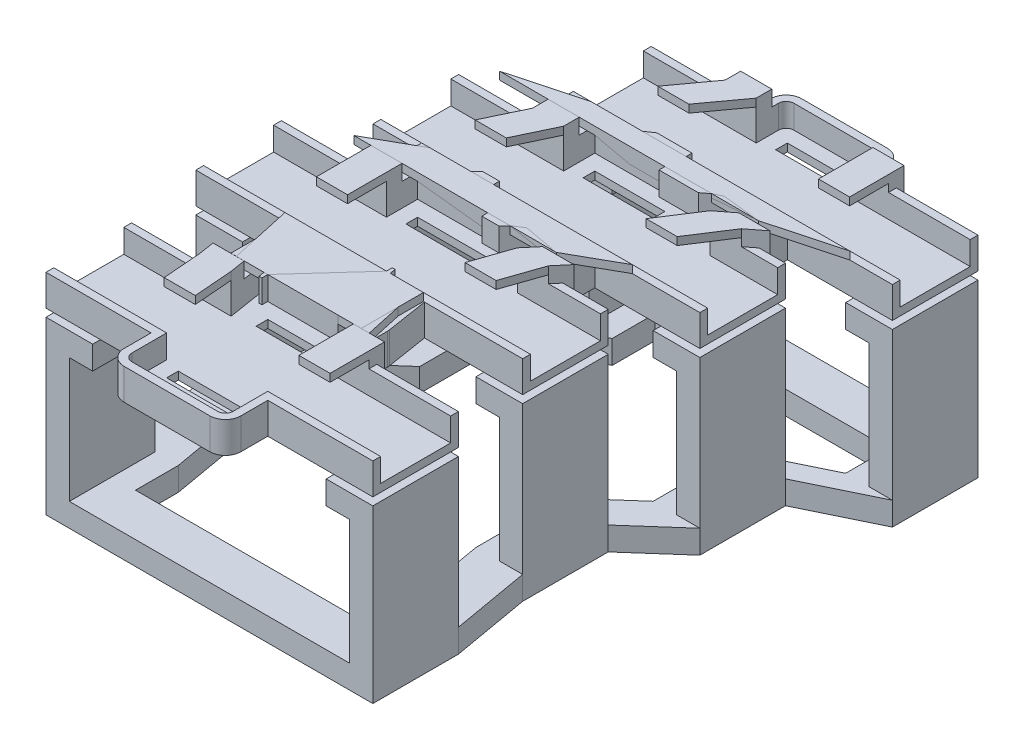
from build123d import *

# Parameters (mm, degrees)
EXTRUDE_1_DEPTH      = 1
SKETCH_11_W          = 9
SKETCH_11_H          = 1.5
CUT_EXTRUDE_3_DEPTH  = 1
FILLET_2_R           = 1
SKETCH_14_W          = 40
SKETCH_14_H          = 9
EXTRUDE_5_DEPTH      = 1
EXTRUDE_6_DEPTH      = 3
EXTRUDE_6_DEPTH_BACK = 1
SKETCH_16_W          = 1
SKETCH_16_H          = 9
CUT_EXTRUDE_4_DEPTH  = 3
EXTRUDE_START        = 1
EXTRUDE_8_DEPTH      = 1
SKETCH_18_W          = 4
SKETCH_18_H          = 5
EXTRUDE_8_2_DEPTH    = 1
EXTRUDE_8_3_DEPTH    = 1
EXTRUDE_8_4_DEPTH    = 1
EXTRUDE_8_5_DEPTH    = 1
EXTRUDE_8_6_DEPTH    = 1
EXTRUDE_8_7_DEPTH    = 1
EXTRUDE_8_8_DEPTH    = 1
SKETCH_19_W          = 4
SKETCH_19_H          = 1
EXTRUDE_9_DEPTH      = 2
EXTRUDE_START_2      = 3
EXTRUDE_11_DEPTH     = 2
EXTRUDE_11_2_DEPTH   = 2
EXTRUDE_11_3_DEPTH   = 2
EXTRUDE_12_DEPTH     = 1
SKETCH_23_W          = 4
SKETCH_23_H          = 1
EXTRUDE_13_DEPTH     = 6
SKETCH_24_W          = 3
SKETCH_24_H          = 11
EXTRUDE_14_DEPTH     = 22
EXTRUDE_14_2_DEPTH   = 22
EXTRUDE_14_3_DEPTH   = 22
EXTRUDE_14_4_DEPTH   = 22
EXTRUDE_14_5_DEPTH   = 22
EXTRUDE_14_6_DEPTH   = 22
EXTRUDE_14_7_DEPTH   = 22
EXTRUDE_14_8_DEPTH   = 22
SKETCH_25_W          = 3
SKETCH_25_H          = 11
EXTRUDE_15_DEPTH     = 3
EXTRUDE_16_DEPTH     = 3
EXTRUDE_START_3      = 2
EXTRUDE_17_DEPTH     = 2
EXTRUDE_17_2_DEPTH   = 2
EXTRUDE_17_3_DEPTH   = 2
EXTRUDE_18_DEPTH     = 1


with BuildPart() as part:
    # 草图5 → 凸台-拉伸1 (new body)
    with BuildSketch(Plane(origin=(0, 0, 0), x_dir=(1, 0, 0), z_dir=(0, 1, 0))):
        Polygon((-30, -9.95), (-17, -9.95), (-17, 9.95), (-18.75, 21), (-12.5, 28.372711642), (-12.5, 37.522711642), (-3.25, 44.664645027), (-3.25, 61.364645027), (-16.25, 61.364645027), (-16.25, 53.014645027), (-25.5, 46.672711642), (-25.5, 37.522711642), (-31.75, 30.95), (-31.75, 11.05), (-30, 0), align=None)
    extrude(amount=EXTRUDE_1_DEPTH)

    # 草图11 → 切除-拉伸3 (cut)
    with BuildSketch(Plane(origin=(0, 1, 0), x_dir=(1, 0, 0), z_dir=(0, 1, 0))):
        with Locations((-23.5, -5.75)):
            Rectangle(SKETCH_11_W, SKETCH_11_H)
        with Locations((-23.5, 5.75)):
            Rectangle(SKETCH_11_W, SKETCH_11_H)
        with Locations((-25.25, 15.25)):
            Rectangle(SKETCH_11_W, SKETCH_11_H)
        with Locations((-25.25, 26.75)):
            Rectangle(SKETCH_11_W, SKETCH_11_H)
        with Locations((-19, 31.772711642)):
            Rectangle(SKETCH_11_W, SKETCH_11_H)
        with Locations((-19, 43.272711642)):
            Rectangle(SKETCH_11_W, SKETCH_11_H)
        with Locations((-9.75, 47.264645027)):
            Rectangle(SKETCH_11_W, SKETCH_11_H)
        with Locations((-9.75, 58.764645027)):
            Rectangle(SKETCH_11_W, SKETCH_11_H)
    extrude(amount=-CUT_EXTRUDE_3_DEPTH, mode=Mode.SUBTRACT)

    # 圆角2
    fillet_2_edges = [part.edges().sort_by_distance(p)[0] for p in [
        (-31.75, 0.5, -11.05),
        (-30, 0.5, 0),
        (-30, 0.5, 9.95),
        (-17, 0.5, 9.95),
        (-17, 0.5, -9.95),
        (-18.75, 0.5, -21),
        (-12.5, 0.5, -28.372711642),
        (-12.5, 0.5, -37.522711642),
        (-3.25, 0.5, -44.664645027),
        (-3.25, 0.5, -61.364645027),
        (-16.25, 0.5, -61.364645027),
        (-16.25, 0.5, -53.014645027),
        (-25.5, 0.5, -46.672711642),
        (-25.5, 0.5, -37.522711642),
        (-31.75, 0.5, -30.95),
    ]]
    fillet(fillet_2_edges, radius=FILLET_2_R)

    # 草图14 → 凸台-拉伸5 (add)
    with BuildSketch(Plane(origin=(0, 1, 0), x_dir=(1, 0, 0), z_dir=(0, 1, 0))):
        with Locations((-23.5, 0)):
            Rectangle(SKETCH_14_W, SKETCH_14_H)
        with Locations((-25.25, 21)):
            Rectangle(SKETCH_14_W, SKETCH_14_H)
        with Locations((-19, 37.522711642)):
            Rectangle(SKETCH_14_W, SKETCH_14_H)
        with Locations((-9.75, 53.014645027)):
            Rectangle(SKETCH_14_W, SKETCH_14_H)
    extrude(amount=-EXTRUDE_5_DEPTH)

    # 草图15 → 凸台-拉伸6 (add, two sides: drawn at the far end of the back side and taken through both)
    with BuildSketch(Plane(origin=(0, 1, 0), x_dir=(1, 0, 0), z_dir=(0, 1, 0)).offset(-EXTRUDE_6_DEPTH_BACK)):
        with BuildLine():
            Line((-17.25, 60.364645027), (-17.25, 58.514645027))
            Line((-17.25, 58.514645027), (-30.75, 58.514645027))
            Line((-30.75, 58.514645027), (-30.75, 47.514645027))
            Line((-30.75, 47.514645027), (-25.958230177, 47.514645027))
            ThreePointArc((-25.958230177, 47.514645027), (-26.359631731, 46.881912962), (-26.5, 46.145862812))
            Line((-26.5, 46.145862812), (-26.5, 43.022711642))
            Line((-26.5, 43.022711642), (-40, 43.022711642))
            Line((-40, 43.022711642), (-40, 32.022711642))
            Line((-40, 32.022711642), (-32.109889455, 32.022711642))
            Line((-32.109889455, 32.022711642), (-32.19934642, 31.928635668))
            ThreePointArc((-32.19934642, 31.928635668), (-32.607241616, 31.292510645), (-32.75, 30.550450283))
            Line((-32.75, 30.550450283), (-32.75, 26.5))
            Line((-32.75, 26.5), (-46.25, 26.5))
            Line((-46.25, 26.5), (-46.25, 15.5))
            Line((-46.25, 15.5), (-32.75, 15.5))
            Line((-32.75, 15.5), (-32.75, 11.12869513))
            ThreePointArc((-32.75, 11.12869513), (-32.743835693, 10.97178997), (-32.725380771, 10.815852022))
            Line((-32.725380771, 10.815852022), (-31.883503754, 5.5))
            Line((-31.883503754, 5.5), (-44.5, 5.5))
            Line((-44.5, 5.5), (-44.5, -5.5))
            Line((-44.5, -5.5), (-31, -5.5))
            Line((-31, -5.5), (-31, -8.95))
            ThreePointArc((-31, -8.95), (-30.414213562, -10.364213562), (-29, -10.95))
            Line((-29, -10.95), (-18, -10.95))
            ThreePointArc((-18, -10.95), (-16.585786438, -10.364213562), (-16, -8.95))
            Line((-16, -8.95), (-16, -5.5))
            Line((-16, -5.5), (-2.5, -5.5))
            Line((-2.5, -5.5), (-2.5, 5.5))
            Line((-2.5, 5.5), (-16, 5.5))
            Line((-16, 5.5), (-16, 9.87130487))
            ThreePointArc((-16, 9.87130487), (-16.006164307, 10.02821003), (-16.024619229, 10.184147978))
            Line((-16.024619229, 10.184147978), (-16.866496246, 15.5))
            Line((-16.866496246, 15.5), (-4.25, 15.5))
            Line((-4.25, 15.5), (-4.25, 26.5))
            Line((-4.25, 26.5), (-12.776570938, 26.5))
            Line((-12.776570938, 26.5), (-11.974406742, 27.446260049))
            ThreePointArc((-11.974406742, 27.446260049), (-11.62234368, 28.050765068), (-11.5, 28.739536977))
            Line((-11.5, 28.739536977), (-11.5, 32.022711642))
            Line((-11.5, 32.022711642), (2, 32.022711642))
            Line((2, 32.022711642), (2, 43.022711642))
            Line((2, 43.022711642), (-3.740284512, 43.022711642))
            Line((-3.740284512, 43.022711642), (-3.027725945, 43.572878758))
            ThreePointArc((-3.027725945, 43.572878758), (-2.454930627, 44.274040672), (-2.25, 45.155928389))
            Line((-2.25, 45.155928389), (-2.25, 47.514645027))
            Line((-2.25, 47.514645027), (11.25, 47.514645027))
            Line((11.25, 47.514645027), (11.25, 58.514645027))
            Line((11.25, 58.514645027), (-2.25, 58.514645027))
            Line((-2.25, 58.514645027), (-2.25, 60.364645027))
            ThreePointArc((-2.25, 60.364645027), (-2.835786438, 61.778858589), (-4.25, 62.364645027))
            Line((-4.25, 62.364645027), (-15.25, 62.364645027))
            ThreePointArc((-15.25, 62.364645027), (-16.664213562, 61.778858589), (-17.25, 60.364645027))
        make_face()
        with BuildLine():
            Line((-16.25, 60.364645027), (-16.25, 57.514645027))
            Line((-16.25, 57.514645027), (-29.75, 57.514645027))
            Line((-29.75, 57.514645027), (-29.75, 48.514645027))
            Line((-29.75, 48.514645027), (-22.813455885, 48.514645027))
            Line((-22.813455885, 48.514645027), (-25.065472331, 46.970630078))
            ThreePointArc((-25.065472331, 46.970630078), (-25.384723779, 46.6119785), (-25.5, 46.145862812))
            Line((-25.5, 46.145862812), (-25.5, 42.022711642))
            Line((-25.5, 42.022711642), (-39, 42.022711642))
            Line((-39, 42.022711642), (-39, 33.022711642))
            Line((-39, 33.022711642), (-29.779055819, 33.022711642))
            Line((-29.779055819, 33.022711642), (-31.47467321, 31.239542976))
            ThreePointArc((-31.47467321, 31.239542976), (-31.678620808, 30.921480464), (-31.75, 30.550450283))
            Line((-31.75, 30.550450283), (-31.75, 25.5))
            Line((-31.75, 25.5), (-45.25, 25.5))
            Line((-45.25, 25.5), (-45.25, 16.5))
            Line((-45.25, 16.5), (-31.75, 16.5))
            Line((-31.75, 16.5), (-31.75, 11.12869513))
            ThreePointArc((-31.75, 11.12869513), (-31.746917847, 11.05024255), (-31.737690385, 10.972273576))
            Line((-31.737690385, 10.972273576), (-30.712669683, 4.5))
            Line((-30.712669683, 4.5), (-43.5, 4.5))
            Line((-43.5, 4.5), (-43.5, -4.5))
            Line((-43.5, -4.5), (-30, -4.5))
            Line((-30, -4.5), (-30, -8.95))
            ThreePointArc((-30, -8.95), (-29.707106781, -9.657106781), (-29, -9.95))
            Line((-29, -9.95), (-18, -9.95))
            ThreePointArc((-18, -9.95), (-17.292893219, -9.657106781), (-17, -8.95))
            Line((-17, -8.95), (-17, -4.5))
            Line((-17, -4.5), (-3.5, -4.5))
            Line((-3.5, -4.5), (-3.5, 4.5))
            Line((-3.5, 4.5), (-17, 4.5))
            Line((-17, 4.5), (-17, 9.87130487))
            ThreePointArc((-17, 9.87130487), (-17.003082153, 9.94975745), (-17.012309615, 10.027726424))
            Line((-17.012309615, 10.027726424), (-18.037330317, 16.5))
            Line((-18.037330317, 16.5), (-5.25, 16.5))
            Line((-5.25, 16.5), (-5.25, 25.5))
            Line((-5.25, 25.5), (-14.935257017, 25.5))
            Line((-14.935257017, 25.5), (-12.737203371, 28.092898513))
            ThreePointArc((-12.737203371, 28.092898513), (-12.56117184, 28.395151022), (-12.5, 28.739536977))
            Line((-12.5, 28.739536977), (-12.5, 33.022711642))
            Line((-12.5, 33.022711642), (1, 33.022711642))
            Line((1, 33.022711642), (1, 42.022711642))
            Line((1, 42.022711642), (-6.671746255, 42.022711642))
            Line((-6.671746255, 42.022711642), (-3.638862972, 44.364403573))
            ThreePointArc((-3.638862972, 44.364403573), (-3.352465313, 44.71498453), (-3.25, 45.155928389))
            Line((-3.25, 45.155928389), (-3.25, 48.514645027))
            Line((-3.25, 48.514645027), (10.25, 48.514645027))
            Line((10.25, 48.514645027), (10.25, 57.514645027))
            Line((10.25, 57.514645027), (-3.25, 57.514645027))
            Line((-3.25, 57.514645027), (-3.25, 60.364645027))
            ThreePointArc((-3.25, 60.364645027), (-3.542893219, 61.071751808), (-4.25, 61.364645027))
            Line((-4.25, 61.364645027), (-15.25, 61.364645027))
            ThreePointArc((-15.25, 61.364645027), (-15.957106781, 61.071751808), (-16.25, 60.364645027))
        make_face(mode=Mode.SUBTRACT)
    extrude(amount=EXTRUDE_6_DEPTH + EXTRUDE_6_DEPTH_BACK)

    # 草图16 → 切除-拉伸4 (cut)
    with BuildSketch(Plane(origin=(0, 4, 0), x_dir=(1, 0, 0), z_dir=(0, 1, 0))):
        with Locations((-44, 0)):
            Rectangle(SKETCH_16_W, SKETCH_16_H)
        with Locations((-3, 0)):
            Rectangle(SKETCH_16_W, SKETCH_16_H)
        with Locations((-45.75, 21)):
            Rectangle(SKETCH_16_W, SKETCH_16_H)
        with Locations((-4.75, 21)):
            Rectangle(SKETCH_16_W, SKETCH_16_H)
        with Locations((-39.5, 37.522711642)):
            Rectangle(SKETCH_16_W, SKETCH_16_H)
        with Locations((1.5, 37.522711642)):
            Rectangle(SKETCH_16_W, SKETCH_16_H)
        with Locations((10.75, 53.014645027)):
            Rectangle(SKETCH_16_W, SKETCH_16_H)
        with Locations((-30.25, 53.014645027)):
            Rectangle(SKETCH_16_W, SKETCH_16_H)
    extrude(amount=-CUT_EXTRUDE_4_DEPTH, mode=Mode.SUBTRACT)



with BuildPart() as body_2:
    # 草图18 → 凸台-拉伸8 (new body)
    with BuildSketch(Plane(origin=(0, 4, 0), x_dir=(1, 0, 0), z_dir=(0, 1, 0)).offset(EXTRUDE_START)):
        Polygon((-34.316742081, -0.5), (-30.316742081, -0.5), (-30.712669683, 4.5), (-34.712669683, 4.5), align=None)
    extrude(amount=EXTRUDE_8_DEPTH)


with BuildPart() as body_3:
    # 草图18 → Extrude 8 2 (new body)
    with BuildSketch(Plane(origin=(0, 4, 0), x_dir=(1, 0, 0), z_dir=(0, 1, 0)).offset(EXTRUDE_START)):
        with Locations((-15, 2)):
            Rectangle(SKETCH_18_W, SKETCH_18_H)
    extrude(amount=EXTRUDE_8_2_DEPTH)


with BuildPart() as body_4:
    # 草图18 → Extrude 8 3 (new body)
    with BuildSketch(Plane(origin=(0, 4, 0), x_dir=(1, 0, 0), z_dir=(0, 1, 0)).offset(EXTRUDE_START)):
        with Locations((-33.75, 23)):
            Rectangle(SKETCH_18_W, SKETCH_18_H)
    extrude(amount=EXTRUDE_8_3_DEPTH)


with BuildPart() as body_5:
    # 草图18 → Extrude 8 4 (new body)
    with BuildSketch(Plane(origin=(0, 4, 0), x_dir=(1, 0, 0), z_dir=(0, 1, 0)).offset(EXTRUDE_START)):
        Polygon((-14.935257017, 25.5), (-16.658631073, 20.5), (-12.658631073, 20.5), (-10.935257017, 25.5), align=None)
    extrude(amount=EXTRUDE_8_4_DEPTH)


with BuildPart() as body_6:
    # 草图18 → Extrude 8 5 (new body)
    with BuildSketch(Plane(origin=(0, 4, 0), x_dir=(1, 0, 0), z_dir=(0, 1, 0)).offset(EXTRUDE_START)):
        Polygon((-31.877253233, 37.022711642), (-27.877253233, 37.022711642), (-25.5, 42.022711642), (-29.5, 42.022711642), align=None)
    extrude(amount=EXTRUDE_8_5_DEPTH)


with BuildPart() as body_7:
    # 草图18 → Extrude 8 6 (new body)
    with BuildSketch(Plane(origin=(0, 4, 0), x_dir=(1, 0, 0), z_dir=(0, 1, 0)).offset(EXTRUDE_START)):
        Polygon((-6.671746255, 42.022711642), (-9.909665002, 37.022711642), (-5.909665002, 37.022711642), (-2.671746255, 42.022711642), align=None)
    extrude(amount=EXTRUDE_8_6_DEPTH)


with BuildPart() as body_8:
    # 草图18 → Extrude 8 7 (new body)
    with BuildSketch(Plane(origin=(0, 4, 0), x_dir=(1, 0, 0), z_dir=(0, 1, 0)).offset(EXTRUDE_START)):
        Polygon((-23.896364381, 52.514645027), (-19.896364381, 52.514645027), (-16.25, 57.514645027), (-20.25, 57.514645027), align=None)
    extrude(amount=EXTRUDE_8_7_DEPTH)


with BuildPart() as body_9:
    # 草图18 → Extrude 8 8 (new body)
    with BuildSketch(Plane(origin=(0, 4, 0), x_dir=(1, 0, 0), z_dir=(0, 1, 0)).offset(EXTRUDE_START)):
        with Locations((-1.25, 55.014645027)):
            Rectangle(SKETCH_18_W, SKETCH_18_H)
    extrude(amount=EXTRUDE_8_8_DEPTH)


with BuildPart() as part_1:
    add(part.part)

    add(body_2.part)  # 凸台-拉伸9 merges body 2

    add(body_3.part)  # 凸台-拉伸9 merges body 3

    add(body_4.part)  # 凸台-拉伸9 merges body 4

    add(body_5.part)  # 凸台-拉伸9 merges body 5

    add(body_6.part)  # 凸台-拉伸9 merges body 6

    add(body_7.part)  # 凸台-拉伸9 merges body 7

    add(body_8.part)  # 凸台-拉伸9 merges body 8

    add(body_9.part)  # 凸台-拉伸9 merges body 9
    # 草图19 → 凸台-拉伸9 (add)
    with BuildSketch(Plane(origin=(0, 4, 0), x_dir=(1, 0, 0), z_dir=(0, 1, 0))):
        Polygon((-34.712669683, 4.5), (-30.712669683, 4.5), (-30.871040724, 5.5), (-34.871040724, 5.5), align=None)
        with Locations((-15, 5)):
            Rectangle(SKETCH_19_W, SKETCH_19_H)
        Polygon((-10.935257017, 25.5), (-14.935257017, 25.5), (-14.087536354, 26.5), (-10.087536354, 26.5), align=None)
        with Locations((-33.75, 26)):
            Rectangle(SKETCH_19_W, SKETCH_19_H)
        Polygon((-2.671746255, 42.022711642), (-6.671746255, 42.022711642), (-5.376578756, 43.022711642), (-1.376578756, 43.022711642), align=None)
        with Locations((-27.5, 42.522711642)):
            Rectangle(SKETCH_19_W, SKETCH_19_H)
        with Locations((-18.25, 58.014645027)):
            Rectangle(SKETCH_19_W, SKETCH_19_H)
        with Locations((-1.25, 58.014645027)):
            Rectangle(SKETCH_19_W, SKETCH_19_H)
    extrude(amount=EXTRUDE_9_DEPTH)

    # 草图23 → 凸台-拉伸13 (add)
    with BuildSketch(Plane(origin=(0, 6, 0), x_dir=(1, 0, 0), z_dir=(0, 1, 0))):
        with Locations((-15, 6)):
            Rectangle(SKETCH_23_W, SKETCH_23_H)
        Polygon((-34.871040724, 5.5), (-30.871040724, 5.5), (-31.027462278, 6.487690385), (-35.027462278, 6.487690385), align=None)
        with Locations((-33.75, 27)):
            Rectangle(SKETCH_23_W, SKETCH_23_H)
        Polygon((-10.087536354, 26.5), (-14.087536354, 26.5), (-13.44089789, 27.262796629), (-9.44089789, 27.262796629), align=None)
        with Locations((-27.5, 43.522711642)):
            Rectangle(SKETCH_23_W, SKETCH_23_H)
        Polygon((-1.376578756, 43.022711642), (-5.376578756, 43.022711642), (-4.58505394, 43.633848669), (-0.58505394, 43.633848669), align=None)
        with Locations((-18.25, 59.014645027)):
            Rectangle(SKETCH_23_W, SKETCH_23_H)
        with Locations((-1.25, 59.014645027)):
            Rectangle(SKETCH_23_W, SKETCH_23_H)
    extrude(amount=-EXTRUDE_13_DEPTH)


with BuildPart() as body_2_2:
    # 草图21 → 凸台-拉伸11 (new body)
    with BuildSketch(Plane(origin=(0, 1, 0), x_dir=(1, 0, 0), z_dir=(0, 1, 0)).offset(EXTRUDE_START_2)):
        Polygon((-29.75, 14.5), (-20.75, 14.5), (-19, 6.5), (-28, 6.5), align=None)
    extrude(amount=EXTRUDE_11_DEPTH)



with BuildPart() as body_3_2:
    # 草图21 → Extrude 11 2 (new body)
    with BuildSketch(Plane(origin=(0, 1, 0), x_dir=(1, 0, 0), z_dir=(0, 1, 0)).offset(EXTRUDE_START_2)):
        Polygon((-23.5, 31.022711642), (-14.5, 31.022711642), (-20.75, 27.5), (-29.75, 27.5), align=None)
    extrude(amount=EXTRUDE_11_2_DEPTH)


with BuildPart() as body_4_2:
    # 草图21 → Extrude 11 3 (new body)
    with BuildSketch(Plane(origin=(0, 1, 0), x_dir=(1, 0, 0), z_dir=(0, 1, 0)).offset(EXTRUDE_START_2)):
        Polygon((-14.25, 46.514645027), (-5.25, 46.514645027), (-14.5, 44.022711642), (-23.5, 44.022711642), align=None)
    extrude(amount=EXTRUDE_11_3_DEPTH)


with BuildPart() as body_2_2_1:
    add(body_2_2.part)

    add(body_3_2.part)  # 凸台-拉伸12 merges body 3 2

    add(body_4_2.part)  # 凸台-拉伸12 merges body 4 2
    # 草图22 → 凸台-拉伸12 (add)
    with BuildSketch(Plane(origin=(0, 6, 0), x_dir=(1, 0, 0), z_dir=(0, 1, 0))):
        Polygon((-19, 6.5), (-20.75, 14.5), (-16.708125206, 14.5), (-14.958125206, 6.5), align=None)
        Polygon((-29.75, 14.5), (-28, 6.5), (-32.041874794, 6.5), (-33.791874794, 14.5), align=None)
        Polygon((-14.5, 31.022711642), (-20.75, 27.5), (-11.928850275, 27.5), (-5.678850275, 31.022711642), align=None)
        Polygon((-29.75, 27.5), (-23.5, 31.022711642), (-31.680858406, 31.022711642), (-37.930858406, 27.5), align=None)
        Polygon((-5.25, 46.514645027), (-14.5, 44.022711642), (-2.445117013, 44.022711642), (6.804882987, 46.514645027), align=None)
        Polygon((-23.5, 44.022711642), (-14.25, 46.514645027), (-26.465705898, 46.514645027), (-35.715705898, 44.022711642), align=None)
    extrude(amount=-EXTRUDE_12_DEPTH)


with BuildPart() as body_3_3:
    # 草图24 → 凸台-拉伸14 (new body)
    with BuildSketch(Plane.XZ.offset(EXTRUDE_START)):
        with Locations((-43, 0)):
            Rectangle(SKETCH_24_W, SKETCH_24_H)
    extrude(amount=EXTRUDE_14_DEPTH)



with BuildPart() as body_4_3:
    # 草图24 → Extrude 14 2 (new body)
    with BuildSketch(Plane.XZ.offset(EXTRUDE_START)):
        with Locations((-44.75, -21)):
            Rectangle(SKETCH_24_W, SKETCH_24_H)
    extrude(amount=EXTRUDE_14_2_DEPTH)


with BuildPart() as body_5_2:
    # 草图24 → Extrude 14 3 (new body)
    with BuildSketch(Plane.XZ.offset(EXTRUDE_START)):
        with Locations((-38.5, -37.522711642)):
            Rectangle(SKETCH_24_W, SKETCH_24_H)
    extrude(amount=EXTRUDE_14_3_DEPTH)


with BuildPart() as body_6_2:
    # 草图24 → Extrude 14 4 (new body)
    with BuildSketch(Plane.XZ.offset(EXTRUDE_START)):
        with Locations((-29.25, -53.014645027)):
            Rectangle(SKETCH_24_W, SKETCH_24_H)
    extrude(amount=EXTRUDE_14_4_DEPTH)


with BuildPart() as body_7_2:
    # 草图24 → Extrude 14 5 (new body)
    with BuildSketch(Plane.XZ.offset(EXTRUDE_START)):
        with Locations((-4, 0)):
            Rectangle(SKETCH_24_W, SKETCH_24_H)
    extrude(amount=EXTRUDE_14_5_DEPTH)


with BuildPart() as body_8_2:
    # 草图24 → Extrude 14 6 (new body)
    with BuildSketch(Plane.XZ.offset(EXTRUDE_START)):
        with Locations((-5.75, -21)):
            Rectangle(SKETCH_24_W, SKETCH_24_H)
    extrude(amount=EXTRUDE_14_6_DEPTH)


with BuildPart() as body_9_2:
    # 草图24 → Extrude 14 7 (new body)
    with BuildSketch(Plane.XZ.offset(EXTRUDE_START)):
        with Locations((0.5, -37.522711642)):
            Rectangle(SKETCH_24_W, SKETCH_24_H)
    extrude(amount=EXTRUDE_14_7_DEPTH)


with BuildPart() as body_10:
    # 草图24 → Extrude 14 8 (new body)
    with BuildSketch(Plane.XZ.offset(EXTRUDE_START)):
        with Locations((9.75, -53.014645027)):
            Rectangle(SKETCH_24_W, SKETCH_24_H)
    extrude(amount=EXTRUDE_14_8_DEPTH)


with BuildPart() as body_3_3_1:
    add(body_3_3.part)

    add(body_4_3.part)  # 凸台-拉伸15 merges body 4 3

    add(body_5_2.part)  # 凸台-拉伸15 merges body 5 2

    add(body_6_2.part)  # 凸台-拉伸15 merges body 6 2

    add(body_7_2.part)  # 凸台-拉伸15 merges body 7 2

    add(body_8_2.part)  # 凸台-拉伸15 merges body 8 2

    add(body_9_2.part)  # 凸台-拉伸15 merges body 9 2

    add(body_10.part)  # 凸台-拉伸15 merges body 10
    # 草图25 → 凸台-拉伸15 (add)
    with BuildSketch(Plane.XZ.offset(EXTRUDE_START)):
        with Locations((-40, 0)):
            Rectangle(SKETCH_25_W, SKETCH_25_H)
        with Locations((-7, 0)):
            Rectangle(SKETCH_25_W, SKETCH_25_H)
        with Locations((-41.75, -21)):
            Rectangle(SKETCH_25_W, SKETCH_25_H)
        with Locations((-8.75, -21)):
            Rectangle(SKETCH_25_W, SKETCH_25_H)
        with Locations((-35.5, -37.522711642)):
            Rectangle(SKETCH_25_W, SKETCH_25_H)
        with Locations((-2.5, -37.522711642)):
            Rectangle(SKETCH_25_W, SKETCH_25_H)
        with Locations((-26.25, -53.014645027)):
            Rectangle(SKETCH_25_W, SKETCH_25_H)
        with Locations((6.75, -53.014645027)):
            Rectangle(SKETCH_25_W, SKETCH_25_H)
    extrude(amount=EXTRUDE_15_DEPTH)

    # 草图26 → 凸台-拉伸16 (add)
    with BuildSketch(Plane.XZ.offset(23)):
        Polygon((-44.5, 5.5), (-44.5, -5.5), (-46.25, -15.5), (-46.25, -26.5), (-40, -32.022711642), (-40, -43.022711642), (-30.75, -47.514645027), (-30.75, -58.514645027), (11.25, -58.514645027), (11.25, -47.514645027), (2, -43.022711642), (2, -32.022711642), (-4.25, -26.5), (-4.25, -15.5), (-2.5, -5.5), (-2.5, 5.5), align=None)
        Polygon((-38.5, -5.5), (-38.5, 0), (-8.5, 0), (-8.5, -5.5), (-10.25, -15.5), (-10.25, -26.5), (-4, -32.022711642), (-4, -43.022711642), (5.25, -47.514645027), (5.25, -53.014645027), (-24.75, -53.014645027), (-24.75, -47.514645027), (-34, -43.022711642), (-34, -32.022711642), (-40.25, -26.5), (-40.25, -15.5), align=None, mode=Mode.SUBTRACT)
    extrude(amount=-EXTRUDE_16_DEPTH)


with BuildPart() as body_4_4:
    # 草图27 → 凸台-拉伸17 (new body)
    with BuildSketch(Plane(origin=(0, 1, 0), x_dir=(1, 0, 0), z_dir=(0, 1, 0)).offset(EXTRUDE_START_3)):
        Polygon((-20.75, 14.5), (-29.75, 14.5), (-28.364253394, 5.75), (-28, 5.75), (-28, 6.5), (-19, 6.5), (-20.385746606, 15.25), (-20.75, 15.25), align=None)
    extrude(amount=EXTRUDE_17_DEPTH)



with BuildPart() as body_5_3:
    # 草图27 → Extrude 17 2 (new body)
    with BuildSketch(Plane(origin=(0, 1, 0), x_dir=(1, 0, 0), z_dir=(0, 1, 0)).offset(EXTRUDE_START_3)):
        Polygon((-29.75, 27.5), (-20.75, 27.5), (-20.75, 26.75), (-18.562927026, 26.75), (-14.5, 31.022711642), (-23.5, 31.022711642), (-23.5, 31.772711642), (-25.687072974, 31.772711642), align=None)
    extrude(amount=EXTRUDE_17_2_DEPTH)


with BuildPart() as body_6_3:
    # 草图27 → Extrude 17 3 (new body)
    with BuildSketch(Plane(origin=(0, 1, 0), x_dir=(1, 0, 0), z_dir=(0, 1, 0)).offset(EXTRUDE_START_3)):
        Polygon((-23.5, 44.022711642), (-14.5, 44.022711642), (-14.5, 43.272711642), (-9.448846754, 43.272711642), (-5.25, 46.514645027), (-14.25, 46.514645027), (-14.25, 47.264645027), (-18.771491832, 47.264645027), align=None)
    extrude(amount=EXTRUDE_17_3_DEPTH)


with BuildPart() as body_4_4_1:
    add(body_4_4.part)

    add(body_5_3.part)  # 凸台-拉伸18 merges body 5 3

    add(body_6_3.part)  # 凸台-拉伸18 merges body 6 3
    # 草图28 → 凸台-拉伸18 (add)
    with BuildSketch(Plane(origin=(0, 5, 0), x_dir=(1, 0, 0), z_dir=(0, 1, 0))):
        Polygon((-20.266968326, 14.5), (-20.385746606, 15.25), (-20.75, 15.25), (-20.75, 14.5), (-32.75, 14.5), (-32.75, 6.497690385), (-28.482665898, 6.497690385), (-28.364253394, 5.75), (-28, 5.75), (-28, 6.5), (-19, 6.5), (-19.00158371, 6.51), (-16, 6.51), (-16, 14.5), align=None)
        Polygon((-25.687072974, 31.772711642), (-26.400248944, 31.022711642), (-32.75, 31.022711642), (-32.75, 27.51), (-29.740490987, 27.51), (-29.75, 27.5), (-20.75, 27.5), (-20.75, 26.75), (-18.562927026, 26.75), (-17.849751056, 27.5), (-12.5, 27.5), (-12.5, 31.022711642), (-23.5, 31.022711642), (-23.5, 31.772711642), align=None)
        Polygon((-9.448846754, 43.272711642), (-8.47747113, 44.022711642), (-3.25, 44.022711642), (-3.25, 46.514645027), (-14.25, 46.514645027), (-14.25, 47.264645027), (-18.771491832, 47.264645027), (-19.865401146, 46.514645027), (-26.5, 46.514645027), (-26.5, 44.032711642), (-14.5, 44.032711642), (-14.5, 43.272711642), align=None)
    extrude(amount=EXTRUDE_18_DEPTH)


solid = Compound([part_1.part, body_2_2_1.part, body_3_3_1.part, body_4_4_1.part])
